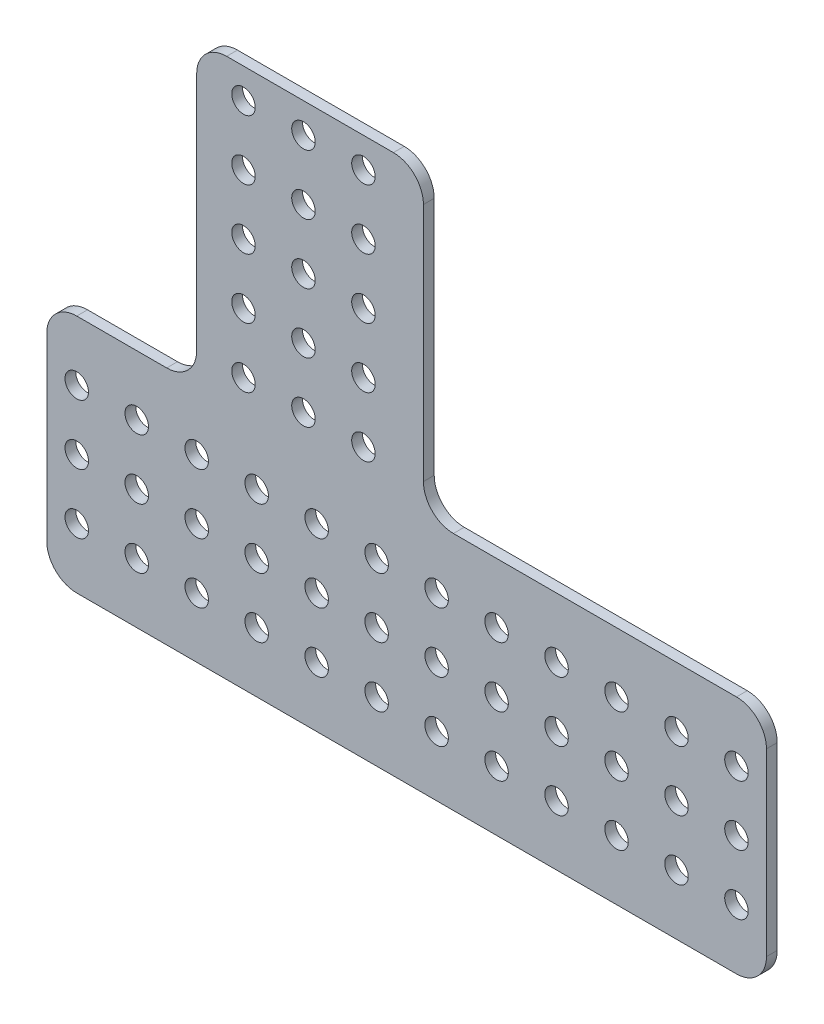
from build123d import *

# Parameters (mm, degrees)
SKETCH1_R           = 2.4892
BOSS_EXTRUDE1_DEPTH = 2.286


with BuildPart() as part:
    # Sketch1 → Boss-Extrude1 (new body)
    with BuildSketch(Plane.XY):
        with BuildLine():
            Line((-255.429010331, 188.842880428), (-220.118407496, 188.842880428))
            ThreePointArc((-220.118407496, 188.842880428), (-215.628279435, 186.983008489), (-213.768407496, 182.492880428))
            Line((-213.768407496, 182.492880428), (-213.768407496, 131.692880428))
            ThreePointArc((-213.768407496, 131.692880428), (-211.908535556, 127.202752368), (-207.418407496, 125.342880428))
            Line((-207.418407496, 125.342880428), (-147.479010331, 125.342880428))
            ThreePointArc((-147.479010331, 125.342880428), (-142.988882271, 123.483008489), (-141.129010331, 118.992880428))
            Line((-141.129010331, 118.992880428), (-141.129010331, 80.892880428))
            ThreePointArc((-141.129010331, 80.892880428), (-142.988882271, 76.402752368), (-147.479010331, 74.542880428))
            Line((-147.479010331, 74.542880428), (-287.179010331, 74.542880428))
            ThreePointArc((-287.179010331, 74.542880428), (-291.669138392, 76.402752368), (-293.529010331, 80.892880428))
            Line((-293.529010331, 80.892880428), (-293.529010331, 118.992880428))
            ThreePointArc((-293.529010331, 118.992880428), (-291.669138392, 123.483008489), (-287.179010331, 125.342880428))
            Line((-287.179010331, 125.342880428), (-268.129010331, 125.342880428))
            ThreePointArc((-268.129010331, 125.342880428), (-263.638882271, 127.202752368), (-261.779010331, 131.692880428))
            Line((-261.779010331, 131.692880428), (-261.779010331, 182.492880428))
            ThreePointArc((-261.779010331, 182.492880428), (-259.919138392, 186.983008489), (-255.429010331, 188.842880428))
        make_face()
        with Locations((-226.468407496, 157.092880428)):
            Circle(SKETCH1_R, mode=Mode.SUBTRACT)
        with Locations((-226.468407496, 144.392880428)):
            Circle(SKETCH1_R, mode=Mode.SUBTRACT)
        with Locations((-226.468407496, 131.692880428)):
            Circle(SKETCH1_R, mode=Mode.SUBTRACT)
        with Locations((-239.168407496, 131.692880428)):
            Circle(SKETCH1_R, mode=Mode.SUBTRACT)
        with Locations((-251.868407496, 131.692880428)):
            Circle(SKETCH1_R, mode=Mode.SUBTRACT)
        with Locations((-251.868407496, 144.392880428)):
            Circle(SKETCH1_R, mode=Mode.SUBTRACT)
        with Locations((-239.168407496, 144.392880428)):
            Circle(SKETCH1_R, mode=Mode.SUBTRACT)
        with Locations((-239.168407496, 157.092880428)):
            Circle(SKETCH1_R, mode=Mode.SUBTRACT)
        with Locations((-251.868407496, 157.092880428)):
            Circle(SKETCH1_R, mode=Mode.SUBTRACT)
        with Locations((-226.468407496, 169.792880428)):
            Circle(SKETCH1_R, mode=Mode.SUBTRACT)
        with Locations((-226.468407496, 182.492880428)):
            Circle(SKETCH1_R, mode=Mode.SUBTRACT)
        with Locations((-239.168407496, 182.492880428)):
            Circle(SKETCH1_R, mode=Mode.SUBTRACT)
        with Locations((-239.168407496, 169.792880428)):
            Circle(SKETCH1_R, mode=Mode.SUBTRACT)
        with Locations((-251.868407496, 169.792880428)):
            Circle(SKETCH1_R, mode=Mode.SUBTRACT)
        with Locations((-251.868407496, 182.492880428)):
            Circle(SKETCH1_R, mode=Mode.SUBTRACT)
        with Locations((-287.179010331, 112.642880428)):
            Circle(SKETCH1_R, mode=Mode.SUBTRACT)
        with Locations((-274.479010331, 112.642880428)):
            Circle(SKETCH1_R, mode=Mode.SUBTRACT)
        with Locations((-261.779010331, 112.642880428)):
            Circle(SKETCH1_R, mode=Mode.SUBTRACT)
        with Locations((-249.079010331, 112.642880428)):
            Circle(SKETCH1_R, mode=Mode.SUBTRACT)
        with Locations((-236.379010331, 112.642880428)):
            Circle(SKETCH1_R, mode=Mode.SUBTRACT)
        with Locations((-223.679010331, 112.642880428)):
            Circle(SKETCH1_R, mode=Mode.SUBTRACT)
        with Locations((-210.979010331, 112.642880428)):
            Circle(SKETCH1_R, mode=Mode.SUBTRACT)
        with Locations((-198.279010331, 112.642880428)):
            Circle(SKETCH1_R, mode=Mode.SUBTRACT)
        with Locations((-185.579010331, 112.642880428)):
            Circle(SKETCH1_R, mode=Mode.SUBTRACT)
        with Locations((-172.879010331, 112.642880428)):
            Circle(SKETCH1_R, mode=Mode.SUBTRACT)
        with Locations((-160.179010331, 112.642880428)):
            Circle(SKETCH1_R, mode=Mode.SUBTRACT)
        with Locations((-147.479010331, 112.642880428)):
            Circle(SKETCH1_R, mode=Mode.SUBTRACT)
        with Locations((-274.479010331, 99.942880428)):
            Circle(SKETCH1_R, mode=Mode.SUBTRACT)
        with Locations((-261.779010331, 99.942880428)):
            Circle(SKETCH1_R, mode=Mode.SUBTRACT)
        with Locations((-249.079010331, 99.942880428)):
            Circle(SKETCH1_R, mode=Mode.SUBTRACT)
        with Locations((-236.379010331, 99.942880428)):
            Circle(SKETCH1_R, mode=Mode.SUBTRACT)
        with Locations((-223.679010331, 99.942880428)):
            Circle(SKETCH1_R, mode=Mode.SUBTRACT)
        with Locations((-210.979010331, 99.942880428)):
            Circle(SKETCH1_R, mode=Mode.SUBTRACT)
        with Locations((-198.279010331, 99.942880428)):
            Circle(SKETCH1_R, mode=Mode.SUBTRACT)
        with Locations((-185.579010331, 99.942880428)):
            Circle(SKETCH1_R, mode=Mode.SUBTRACT)
        with Locations((-172.879010331, 99.942880428)):
            Circle(SKETCH1_R, mode=Mode.SUBTRACT)
        with Locations((-160.179010331, 99.942880428)):
            Circle(SKETCH1_R, mode=Mode.SUBTRACT)
        with Locations((-147.479010331, 99.942880428)):
            Circle(SKETCH1_R, mode=Mode.SUBTRACT)
        with Locations((-274.479010331, 87.242880428)):
            Circle(SKETCH1_R, mode=Mode.SUBTRACT)
        with Locations((-261.779010331, 87.242880428)):
            Circle(SKETCH1_R, mode=Mode.SUBTRACT)
        with Locations((-249.079010331, 87.242880428)):
            Circle(SKETCH1_R, mode=Mode.SUBTRACT)
        with Locations((-236.379010331, 87.242880428)):
            Circle(SKETCH1_R, mode=Mode.SUBTRACT)
        with Locations((-223.679010331, 87.242880428)):
            Circle(SKETCH1_R, mode=Mode.SUBTRACT)
        with Locations((-210.979010331, 87.242880428)):
            Circle(SKETCH1_R, mode=Mode.SUBTRACT)
        with Locations((-198.279010331, 87.242880428)):
            Circle(SKETCH1_R, mode=Mode.SUBTRACT)
        with Locations((-185.579010331, 87.242880428)):
            Circle(SKETCH1_R, mode=Mode.SUBTRACT)
        with Locations((-172.879010331, 87.242880428)):
            Circle(SKETCH1_R, mode=Mode.SUBTRACT)
        with Locations((-160.179010331, 87.242880428)):
            Circle(SKETCH1_R, mode=Mode.SUBTRACT)
        with Locations((-147.479010331, 87.242880428)):
            Circle(SKETCH1_R, mode=Mode.SUBTRACT)
        with Locations((-287.179010331, 99.942880428)):
            Circle(SKETCH1_R, mode=Mode.SUBTRACT)
        with Locations((-287.179010331, 87.242880428)):
            Circle(SKETCH1_R, mode=Mode.SUBTRACT)
    extrude(amount=BOSS_EXTRUDE1_DEPTH)


solid = part.part
